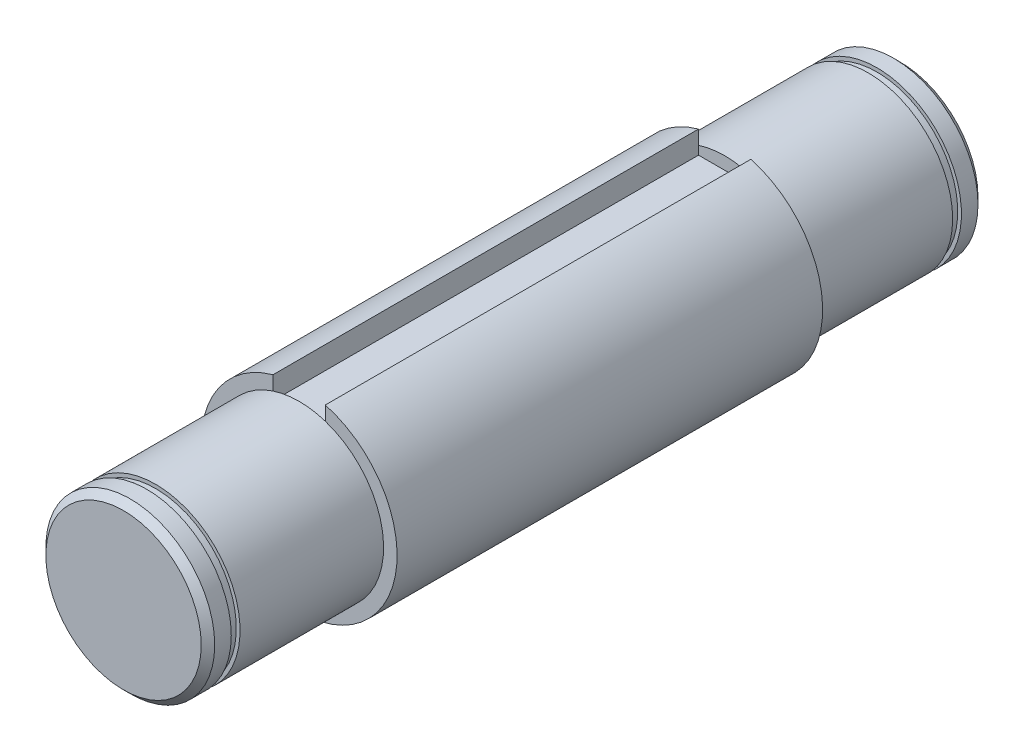
from build123d import *

# Parameters (mm, degrees)
SKETCH1_R                      = 12.5
BOSS_EXTRUDE1_DEPTH            = 115
BOSS_EXTRUDE2_DEPTH            = 31.5
BOSS_EXTRUDE2_DEPTH_BACK       = 31.5
SKETCH2_R                      = 14.5
CUT_EXTRUDE1_REACH             = 63.047
SKETCH3_W                      = 7.75
SKETCH3_H                      = 7.75
CUT_EXTRUDE1_DIRECTION_2_REACH = 63.047
SKETCH4_W                      = 1.1
SKETCH4_H                      = 1.3
CHAMFER1_SIZE                  = 1


with BuildPart() as part:
    # Sketch1 → Boss-Extrude1 (new body)
    with BuildSketch(Plane.XY):
        Circle(SKETCH1_R)
    extrude(amount=BOSS_EXTRUDE1_DEPTH)

    # Sketch2 → Boss-Extrude2 (add, two sides: drawn at the far end of the back side and taken through both)
    with BuildSketch(Plane(origin=(0, 0, 57.5), x_dir=(-1, 0, 0), z_dir=(0, 0, -1)).offset(-BOSS_EXTRUDE2_DEPTH_BACK)):
        Circle(SKETCH2_R)
    extrude(amount=BOSS_EXTRUDE2_DEPTH + BOSS_EXTRUDE2_DEPTH_BACK)

    # Cut-Extrude1: up to this face of the body (flat: up to its plane)
    cut_extrude1_end = Plane(part.part.faces().sort_by_distance((14.089878067, 0, 89))[0])
    # Sketch3 → Cut-Extrude1 (cut, up to the picked face)
    with BuildSketch(Plane(origin=(0, 0, 57.5), x_dir=(-1, 0, 0), z_dir=(0, 0, -1)), mode=Mode.PRIVATE) as cut_extrude1_sk1:
        with Locations((0, 14.5)):
            Rectangle(SKETCH3_W, SKETCH3_H)
    cut_extrude1_tool1 = split(extrude(cut_extrude1_sk1.sketch, amount=-CUT_EXTRUDE1_REACH, mode=Mode.PRIVATE), bisect_by=cut_extrude1_end, keep=Keep.BOTH, mode=Mode.PRIVATE)
    add(cut_extrude1_tool1.solids().sort_by(Axis((0, 14.5, 57.5), (0, 0, 1)))[0], mode=Mode.SUBTRACT)

    # Cut-Extrude1 direction 2: up to this face of the body (flat: up to its plane)
    cut_extrude1_direction_2_end = Plane(part.part.faces().sort_by_distance((14.089878067, 0, 26))[0])
    # Sketch3 → Cut-Extrude1 direction 2 (cut, up to the picked face)
    with BuildSketch(Plane(origin=(0, 0, 57.5), x_dir=(-1, 0, 0), z_dir=(0, 0, -1)), mode=Mode.PRIVATE) as cut_extrude1_direction_2_sk1:
        with Locations((0, 14.5)):
            Rectangle(SKETCH3_W, SKETCH3_H)
    cut_extrude1_direction_2_tool1 = split(extrude(cut_extrude1_direction_2_sk1.sketch, amount=CUT_EXTRUDE1_DIRECTION_2_REACH, mode=Mode.PRIVATE), bisect_by=cut_extrude1_direction_2_end, keep=Keep.BOTH, mode=Mode.PRIVATE)
    add(cut_extrude1_direction_2_tool1.solids().sort_by(Axis((0, 14.5, 57.5), (0, 0, -1)))[0], mode=Mode.SUBTRACT)

    # Sketch4 → Cut-Revolve1 (revolve, cut)
    with BuildSketch(Plane(origin=(0, 0, 0), x_dir=(1, 0, 0), z_dir=(0, 1, 0))):
        with Locations((-12.5, -4.1)):
            Rectangle(SKETCH4_W, SKETCH4_H)
    cut_revolve1 = revolve(axis=Axis((0, 0, 0), (0, 0, 1)), mode=Mode.SUBTRACT)

    # Mirror1: Cut-Revolve1 across plane
    add(cut_revolve1.mirror(Plane(origin=(0, 0, 57.5), x_dir=(1, 0, 0), z_dir=(0, 0, -1))), mode=Mode.SUBTRACT)

    # Chamfer1
    chamfer1_edges = [part.edges().sort_by_distance(p)[0] for p in [
        (-12.5, 0, 0),
        (-12.5, 0, 115),
    ]]
    chamfer(chamfer1_edges, length=CHAMFER1_SIZE)


solid = part.part
